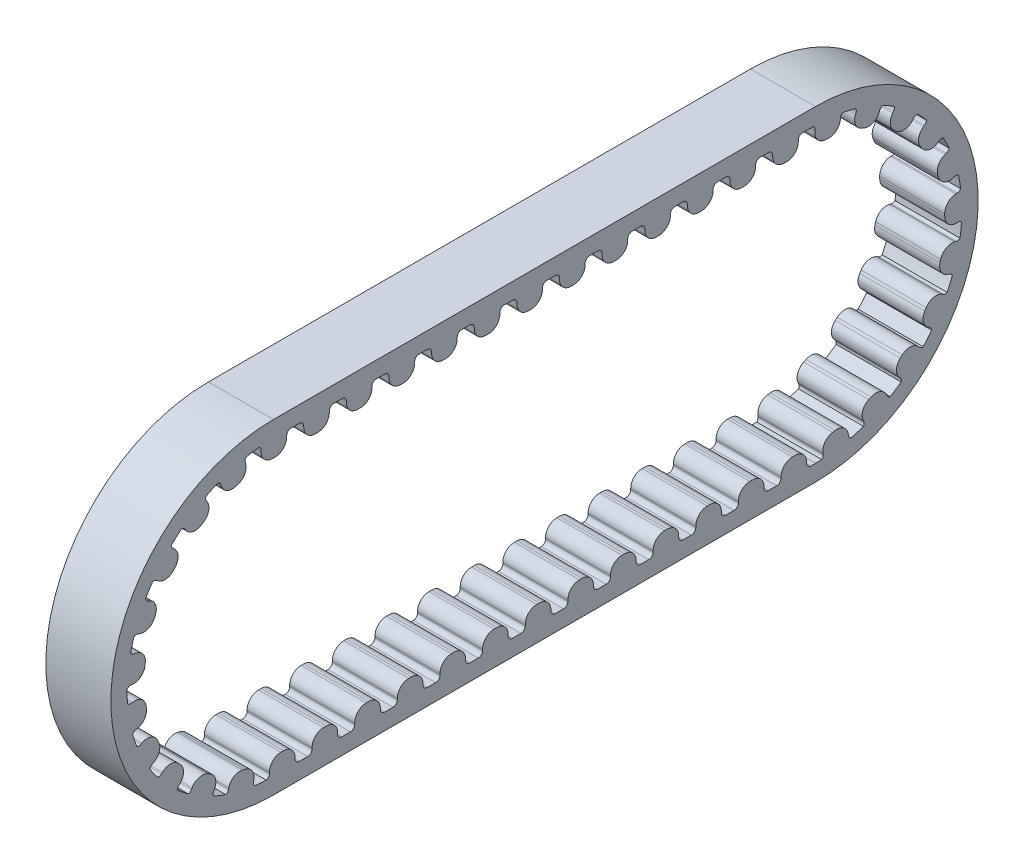
from build123d import *

# Parameters (mm, degrees)
BOSS_EXTRUDE1_DEPTH = 3
BOSS_EXTRUDE2_DEPTH = 3
CRVPATTERN1_DEPTH   = 3


# Read off the part's stored shape, not the designer's step: CrvPattern1
with BuildPart() as part:
    # Sketch1 → Boss-Extrude1 (new body)
    with BuildSketch(Plane(origin=(0, 0, 0), x_dir=(0, 0, -1), z_dir=(1, 0, 0))):
        with BuildLine():
            Line((0, 7.5), (25, 7.5))
            ThreePointArc((25, 7.5), (32.5, 0), (25, -7.5))
            Line((25, -7.5), (0, -7.5))
            ThreePointArc((0, -7.5), (-7.5, 0), (0, 7.5))
        make_face()
        with BuildLine():
            Line((0, 6.75), (25, 6.75))
            ThreePointArc((25, 6.75), (31.75, 0), (25, -6.75))
            Line((25, -6.75), (0, -6.75))
            ThreePointArc((0, -6.75), (-6.75, 0), (0, 6.75))
        make_face(mode=Mode.SUBTRACT)
    extrude(amount=BOSS_EXTRUDE1_DEPTH)

    # Sketch2 → Boss-Extrude2 (add)
    with BuildSketch(Plane(origin=(3, 0, 0), x_dir=(0, 0, -1), z_dir=(1, 0, 0))):
        with BuildLine():
            Line((1.39472131, 6.55), (1.39472131, 6.49))
            ThreePointArc((1.39472131, 6.49), (1.549954716, 6.115233406), (1.92472131, 5.96))
            Line((1.92472131, 5.96), (2.04472131, 5.96))
            ThreePointArc((2.04472131, 5.96), (2.419487904, 6.115233406), (2.57472131, 6.49))
            Line((2.57472131, 6.49), (2.57472131, 6.55))
            ThreePointArc((2.57472131, 6.55), (2.633299954, 6.691421356), (2.77472131, 6.75))
            ThreePointArc((2.77472131, 6.75), (1.98472131, 6.794721429), (1.19472131, 6.75))
            ThreePointArc((1.19472131, 6.75), (1.336142666, 6.691421356), (1.39472131, 6.55))
        make_face()
    extrude(amount=-BOSS_EXTRUDE2_DEPTH)

    # CrvPattern1 outline → CrvPattern1 (add)
    with BuildSketch(Plane.YZ):
        with BuildLine():
            ThreePointArc((6.49, 0.571480835), (6.115233406, 0.416247429), (5.96, 0.041480835))
            Line((5.96, 0.041480835), (5.96, -0.078519165))
            ThreePointArc((5.96, -0.078519165), (6.115233406, -0.453285759), (6.49, -0.608519165))
            Line((6.49, -0.608519165), (6.55, -0.608519165))
            ThreePointArc((6.55, -0.608519165), (6.691421356, -0.667097809), (6.75, -0.808519165))
            Line((6.75, -0.808519165), (6.75, 0))
            ThreePointArc((6.75, 0), (6.741857053, 0.331456604), (6.717447858, 0.662113495))
            ThreePointArc((6.717447858, 0.662113495), (6.645201187, 0.595592422), (6.55, 0.571480835))
            Line((6.55, 0.571480835), (6.49, 0.571480835))
        make_face()
        with BuildLine():
            ThreePointArc((6.55, -4.540923455), (6.691421356, -4.599502099), (6.75, -4.740923455))
            Line((6.75, -4.740923455), (6.75, -3.160923455))
            ThreePointArc((6.75, -3.160923455), (6.691421356, -3.302344811), (6.55, -3.360923455))
            Line((6.55, -3.360923455), (6.49, -3.360923455))
            ThreePointArc((6.49, -3.360923455), (6.115233406, -3.516156861), (5.96, -3.890923455))
            Line((5.96, -3.890923455), (5.96, -4.010923455))
            ThreePointArc((5.96, -4.010923455), (6.115233406, -4.385690049), (6.49, -4.540923455))
            Line((6.49, -4.540923455), (6.55, -4.540923455))
        make_face()
        with BuildLine():
            ThreePointArc((6.55, -6.5071256), (6.691421356, -6.565704244), (6.75, -6.7071256))
            Line((6.75, -6.7071256), (6.75, -5.1271256))
            ThreePointArc((6.75, -5.1271256), (6.691421357, -5.268546957), (6.55, -5.3271256))
            Line((6.55, -5.3271256), (6.49, -5.3271256))
            ThreePointArc((6.49, -5.3271256), (6.115233406, -5.482359006), (5.96, -5.8571256))
            Line((5.96, -5.8571256), (5.96, -5.9771256))
            ThreePointArc((5.96, -5.9771256), (6.115233406, -6.351892194), (6.49, -6.5071256))
            Line((6.49, -6.5071256), (6.55, -6.5071256))
        make_face()
        with BuildLine():
            ThreePointArc((6.55, -8.473327746), (6.691421357, -8.531906389), (6.75, -8.673327746))
            Line((6.75, -8.673327746), (6.75, -7.093327746))
            ThreePointArc((6.75, -7.093327746), (6.691421356, -7.234749102), (6.55, -7.293327746))
            Line((6.55, -7.293327746), (6.49, -7.293327746))
            ThreePointArc((6.49, -7.293327746), (6.115233406, -7.448561152), (5.96, -7.823327746))
            Line((5.96, -7.823327746), (5.96, -7.943327746))
            ThreePointArc((5.96, -7.943327746), (6.115233406, -8.31809434), (6.49, -8.473327746))
            Line((6.49, -8.473327746), (6.55, -8.473327746))
        make_face()
        with BuildLine():
            ThreePointArc((6.55, -10.439529891), (6.691421356, -10.498108535), (6.75, -10.639529891))
            Line((6.75, -10.639529891), (6.75, -9.059529891))
            ThreePointArc((6.75, -9.059529891), (6.691421356, -9.200951247), (6.55, -9.259529891))
            Line((6.55, -9.259529891), (6.49, -9.259529891))
            ThreePointArc((6.49, -9.259529891), (6.115233406, -9.414763297), (5.96, -9.789529891))
            Line((5.96, -9.789529891), (5.96, -9.909529891))
            ThreePointArc((5.96, -9.909529891), (6.115233406, -10.284296485), (6.49, -10.439529891))
            Line((6.49, -10.439529891), (6.55, -10.439529891))
        make_face()
        with BuildLine():
            ThreePointArc((6.55, -12.405732036), (6.691421356, -12.46431068), (6.75, -12.605732036))
            Line((6.75, -12.605732036), (6.75, -11.025732036))
            ThreePointArc((6.75, -11.025732036), (6.691421356, -11.167153392), (6.55, -11.225732036))
            Line((6.55, -11.225732036), (6.49, -11.225732036))
            ThreePointArc((6.49, -11.225732036), (6.115233406, -11.380965442), (5.96, -11.755732036))
            Line((5.96, -11.755732036), (5.96, -11.875732036))
            ThreePointArc((5.96, -11.875732036), (6.115233406, -12.25049863), (6.49, -12.405732036))
            Line((6.49, -12.405732036), (6.55, -12.405732036))
        make_face()
        with BuildLine():
            ThreePointArc((6.55, -14.371934181), (6.691421356, -14.430512825), (6.75, -14.571934181))
            Line((6.75, -14.571934181), (6.75, -12.991934181))
            ThreePointArc((6.75, -12.991934181), (6.691421356, -13.133355537), (6.55, -13.191934181))
            Line((6.55, -13.191934181), (6.49, -13.191934181))
            ThreePointArc((6.49, -13.191934181), (6.115233406, -13.347167587), (5.96, -13.721934181))
            Line((5.96, -13.721934181), (5.96, -13.841934181))
            ThreePointArc((5.96, -13.841934181), (6.115233406, -14.216700775), (6.49, -14.371934181))
            Line((6.49, -14.371934181), (6.55, -14.371934181))
        make_face()
        with BuildLine():
            ThreePointArc((6.55, -16.338136326), (6.691421356, -16.39671497), (6.75, -16.538136326))
            Line((6.75, -16.538136326), (6.75, -14.958136326))
            ThreePointArc((6.75, -14.958136326), (6.691421357, -15.099557683), (6.55, -15.158136326))
            Line((6.55, -15.158136326), (6.49, -15.158136326))
            ThreePointArc((6.49, -15.158136326), (6.115233406, -15.313369732), (5.96, -15.688136326))
            Line((5.96, -15.688136326), (5.96, -15.808136326))
            ThreePointArc((5.96, -15.808136326), (6.115233406, -16.18290292), (6.49, -16.338136326))
            Line((6.49, -16.338136326), (6.55, -16.338136326))
        make_face()
        with BuildLine():
            ThreePointArc((6.55, -18.304338471), (6.691421356, -18.362917115), (6.75, -18.504338471))
            Line((6.75, -18.504338471), (6.75, -16.924338471))
            ThreePointArc((6.75, -16.924338471), (6.691421357, -17.065759827), (6.55, -17.124338471))
            Line((6.55, -17.124338471), (6.49, -17.124338471))
            ThreePointArc((6.49, -17.124338471), (6.115233406, -17.279571877), (5.96, -17.654338471))
            Line((5.96, -17.654338471), (5.96, -17.774338471))
            ThreePointArc((5.96, -17.774338471), (6.115233405, -18.149105065), (6.49, -18.304338471))
            Line((6.49, -18.304338471), (6.55, -18.304338471))
        make_face()
        with BuildLine():
            ThreePointArc((6.55, -20.270540617), (6.691421357, -20.329119261), (6.75, -20.470540617))
            Line((6.75, -20.470540617), (6.75, -18.890540617))
            ThreePointArc((6.75, -18.890540617), (6.691421356, -19.031961973), (6.55, -19.090540617))
            Line((6.55, -19.090540617), (6.49, -19.090540617))
            ThreePointArc((6.49, -19.090540617), (6.115233406, -19.245774023), (5.96, -19.620540617))
            Line((5.96, -19.620540617), (5.96, -19.740540617))
            ThreePointArc((5.96, -19.740540617), (6.115233406, -20.115307211), (6.49, -20.270540617))
            Line((6.49, -20.270540617), (6.55, -20.270540617))
        make_face()
        with BuildLine():
            ThreePointArc((6.55, -22.236742762), (6.691421356, -22.295321406), (6.75, -22.436742762))
            Line((6.75, -22.436742762), (6.75, -20.856742762))
            ThreePointArc((6.75, -20.856742762), (6.691421356, -20.998164118), (6.55, -21.056742762))
            Line((6.55, -21.056742762), (6.49, -21.056742762))
            ThreePointArc((6.49, -21.056742762), (6.115233406, -21.211976168), (5.96, -21.586742762))
            Line((5.96, -21.586742762), (5.96, -21.706742762))
            ThreePointArc((5.96, -21.706742762), (6.115233406, -22.081509356), (6.49, -22.236742762))
            Line((6.49, -22.236742762), (6.55, -22.236742762))
        make_face()
        with BuildLine():
            ThreePointArc((6.55, -24.202944907), (6.691421356, -24.261523551), (6.75, -24.402944907))
            Line((6.75, -24.402944907), (6.75, -22.822944907))
            ThreePointArc((6.75, -22.822944907), (6.691421356, -22.964366263), (6.55, -23.022944907))
            Line((6.55, -23.022944907), (6.49, -23.022944907))
            ThreePointArc((6.49, -23.022944907), (6.115233406, -23.178178313), (5.96, -23.552944907))
            Line((5.96, -23.552944907), (5.96, -23.672944907))
            ThreePointArc((5.96, -23.672944907), (6.115233406, -24.047711501), (6.49, -24.202944907))
            Line((6.49, -24.202944907), (6.55, -24.202944907))
        make_face()
        with BuildLine():
            ThreePointArc((6.475346005, -26.149127546), (6.566914375, -26.180514693), (6.633018294, -26.251226724))
            ThreePointArc((6.633018294, -26.251226724), (6.720690942, -25.628341673), (6.75, -25))
            Line((6.75, -25), (6.75, -24.898864845))
            ThreePointArc((6.75, -24.898864845), (6.672594942, -24.957944108), (6.576465317, -24.973468206))
            Line((6.576465317, -24.973468206), (6.516686028, -24.968326546))
            ThreePointArc((6.516686028, -24.968326546), (6.1299954, -25.090873549), (5.943217651, -25.450958931))
            Line((5.943217651, -25.450958931), (5.932934331, -25.570517508))
            ThreePointArc((5.932934331, -25.570517508), (6.055481334, -25.957208137), (6.415566716, -26.143985886))
            Line((6.415566716, -26.143985886), (6.475346005, -26.149127546))
        make_face()
        with BuildLine():
            ThreePointArc((5.872553441, -27.960357425), (5.951250449, -28.016719649), (5.994262101, -28.103437105))
            ThreePointArc((5.994262101, -28.103437105), (6.275748601, -27.485453579), (6.493718219, -26.842314765))
            ThreePointArc((6.493718219, -26.842314765), (6.402995297, -26.87606785), (6.307047548, -26.863263595))
            Line((6.307047548, -26.863263595), (6.251263116, -26.841170675))
            ThreePointArc((6.251263116, -26.841170675), (5.845668101, -26.847502654), (5.5633465, -27.138779024))
            Line((5.5633465, -27.138779024), (5.519160659, -27.250347888))
            ThreePointArc((5.519160659, -27.250347888), (5.525492638, -27.655942903), (5.816769009, -27.938264504))
            Line((5.816769009, -27.938264504), (5.872553441, -27.960357425))
        make_face()
        with BuildLine():
            ThreePointArc((4.774991529, -29.522173803), (4.834186862, -29.598762522), (4.850482466, -29.694179358))
            ThreePointArc((4.850482466, -29.694179358), (5.297588245, -29.183068107), (5.691077106, -28.629620003))
            ThreePointArc((5.691077106, -28.629620003), (5.594482479, -28.635896744), (5.506253805, -28.596076895))
            Line((5.506253805, -28.596076895), (5.459164132, -28.558894067))
            ThreePointArc((5.459164132, -28.558894067), (5.068836575, -28.448477545), (4.714757041, -28.646404537))
            Line((4.714757041, -28.646404537), (4.640391385, -28.740583884))
            ThreePointArc((4.640391385, -28.740583884), (4.529974864, -29.130911441), (4.727901855, -29.484990975))
            Line((4.727901855, -29.484990975), (4.774991529, -29.522173803))
        make_face()
        with BuildLine():
            ThreePointArc((3.275131115, -30.702991862), (3.309837499, -30.793354389), (3.298044132, -30.889431628))
            ThreePointArc((3.298044132, -30.889431628), (3.873100016, -30.52825436), (4.408956235, -30.111125602))
            ThreePointArc((4.408956235, -30.111125602), (4.314628112, -30.089397175), (4.241551878, -30.0259166))
            Line((4.241551878, -30.0259166), (4.207124322, -29.976776561))
            ThreePointArc((4.207124322, -29.976776561), (3.864949766, -29.758914257), (3.468943904, -29.846816294))
            Line((3.468943904, -29.846816294), (3.370663827, -29.915671406))
            ThreePointArc((3.370663827, -29.915671406), (3.152801523, -30.257845962), (3.24070356, -30.653851823))
            Line((3.24070356, -30.653851823), (3.275131115, -30.702991862))
        make_face()
        with BuildLine():
            ThreePointArc((1.499337157, -31.40332633), (1.506630539, -31.499849519), (1.467741805, -31.588492543))
            ThreePointArc((1.467741805, -31.588492543), (2.122298677, -31.407678856), (2.755375754, -31.16201302))
            ThreePointArc((2.755375754, -31.16201302), (2.671261387, -31.114110071), (2.61949435, -31.03231708))
            Line((2.61949435, -31.03231708), (2.600629473, -30.975359934))
            ThreePointArc((2.600629473, -30.975359934), (2.335436516, -30.668406997), (1.930868274, -30.638878231))
            Line((1.930868274, -30.638878231), (1.816953983, -30.676607986))
            ThreePointArc((1.816953983, -30.676607986), (1.510001045, -30.941800943), (1.48047228, -31.346369185))
            Line((1.48047228, -31.346369185), (1.499337157, -31.40332633))
        make_face()
        with BuildLine():
            ThreePointArc((-0.402777672, -31.564173226), (-0.423511769, -31.658724887), (-0.486219448, -31.732465421))
            ThreePointArc((-0.486219448, -31.732465421), (0.192691247, -31.747249075), (0.869651713, -31.693743788))
            ThreePointArc((0.869651713, -31.693743788), (0.802837833, -31.623702195), (0.776741425, -31.530487942))
            Line((0.776741425, -31.530487942), (0.775028614, -31.470512394))
            ThreePointArc((0.775028614, -31.470512394), (0.609160066, -31.100329959), (0.230114781, -30.955858224))
            Line((0.230114781, -30.955858224), (0.110163687, -30.959283846))
            ThreePointArc((0.110163687, -30.959283846), (-0.260018748, -31.125152394), (-0.404490483, -31.504197679))
            Line((-0.404490483, -31.504197679), (-0.402777672, -31.564173226))
        make_face()
        with BuildLine():
            ThreePointArc((-2.270958022, -31.171981016), (-2.317972725, -31.256595064), (-2.399216157, -31.309220382))
            ThreePointArc((-2.399216157, -31.309220382), (-1.753150642, -31.518355838), (-1.089341481, -31.661518981))
            ThreePointArc((-1.089341481, -31.661518981), (-1.133225727, -31.575239828), (-1.131452853, -31.478457721))
            Line((-1.131452853, -31.478457721), (-1.115869292, -31.42051678))
            ThreePointArc((-1.115869292, -31.42051678), (-1.168438816, -31.018293141), (-1.490026145, -30.771050345))
            Line((-1.490026145, -30.771050345), (-1.605908026, -30.739883223))
            ThreePointArc((-1.605908026, -30.739883223), (-2.008131665, -30.792452746), (-2.255374461, -31.114040075))
            Line((-2.255374461, -31.114040075), (-2.270958022, -31.171981016))
        make_face()
        with BuildLine():
            ThreePointArc((-3.947807559, -30.259792341), (-4.017141826, -30.327339946), (-4.110076158, -30.354416306))
            ThreePointArc((-4.110076158, -30.354416306), (-3.551287582, -30.740283661), (-2.956556408, -31.068053577))
            ThreePointArc((-2.956556408, -31.068053577), (-2.973813723, -30.972805981), (-2.944320934, -30.880610022))
            Line((-2.944320934, -30.880610022), (-2.912753933, -30.829585279))
            ThreePointArc((-2.912753933, -30.829585279), (-2.84759539, -30.429208238), (-3.084630663, -30.10002487))
            Line((-3.084630663, -30.10002487), (-3.18668015, -30.036890869))
            ThreePointArc((-3.18668015, -30.036890869), (-3.587057191, -29.971732325), (-3.916240559, -30.208767598))
            Line((-3.916240559, -30.208767598), (-3.947807559, -30.259792341))
        make_face()
        with BuildLine():
            ThreePointArc((-5.292049792, -28.904460142), (-5.377862131, -28.94925034), (-5.47465754, -28.948496527))
            ThreePointArc((-5.47465754, -28.948496527), (-5.05022448, -29.478586016), (-4.574678073, -29.963347713))
            ThreePointArc((-4.574678073, -29.963347713), (-4.563854509, -29.867156395), (-4.509126607, -29.7873142))
            Line((-4.509126607, -29.7873142), (-4.464235722, -29.747504546))
            ThreePointArc((-4.464235722, -29.747504546), (-4.286838794, -29.382706328), (-4.419351517, -28.999316463))
            Line((-4.419351517, -28.999316463), (-4.498970824, -28.909534694))
            ThreePointArc((-4.498970824, -28.909534694), (-4.863769042, -28.732137766), (-5.247158907, -28.864650489))
            Line((-5.247158907, -28.864650489), (-5.292049792, -28.904460142))
        make_face()
        with BuildLine():
            ThreePointArc((-6.190430772, -27.220172708), (-6.285491396, -27.238431873), (-6.377992758, -27.209911397))
            ThreePointArc((-6.377992758, -27.209911397), (-6.123674185, -27.839562373), (-5.807377876, -28.440474125))
            ThreePointArc((-5.807377876, -28.440474125), (-5.769385329, -28.351443311), (-5.694033202, -28.290681676))
            Line((-5.694033202, -28.290681676), (-5.639600543, -28.265441122))
            ThreePointArc((-5.639600543, -28.265441122), (-5.364911123, -27.966956393), (-5.381736948, -27.561661066))
            Line((-5.381736948, -27.561661066), (-5.432218057, -27.452795747))
            ThreePointArc((-5.432218057, -27.452795747), (-5.730702786, -27.178106328), (-6.135998113, -27.194932153))
            Line((-6.135998113, -27.194932153), (-6.190430772, -27.220172708))
        make_face()
        with BuildLine():
            ThreePointArc((-6.567260876, -25.348833182), (-6.663560818, -25.33902296), (-6.743974786, -25.285138703))
            ThreePointArc((-6.743974786, -25.285138703), (-6.681197332, -25.961302351), (-6.550799446, -26.627736654))
            ThreePointArc((-6.550799446, -26.627736654), (-6.488838833, -26.553367294), (-6.399210983, -26.516805456))
            Line((-6.399210983, -26.516805456), (-6.339822563, -26.508260546))
            ThreePointArc((-6.339822563, -26.508260546), (-5.990983551, -26.301236987), (-5.890704883, -25.908182793))
            Line((-5.890704883, -25.908182793), (-5.907794702, -25.789405952))
            ThreePointArc((-5.907794702, -25.789405952), (-6.114818262, -25.44056694), (-6.507872455, -25.340288272))
            Line((-6.507872455, -25.340288272), (-6.567260876, -25.348833182))
        make_face()
        with BuildLine():
            ThreePointArc((-6.55, -23.408379763), (-6.691421356, -23.349801119), (-6.75, -23.208379763))
            Line((-6.75, -23.208379763), (-6.75, -24.788379763))
            ThreePointArc((-6.75, -24.788379763), (-6.691421356, -24.646958406), (-6.55, -24.588379763))
            Line((-6.55, -24.588379763), (-6.49, -24.588379763))
            ThreePointArc((-6.49, -24.588379763), (-6.115233406, -24.433146357), (-5.96, -24.058379763))
            Line((-5.96, -24.058379763), (-5.96, -23.938379763))
            ThreePointArc((-5.96, -23.938379763), (-6.115233406, -23.563613169), (-6.49, -23.408379763))
            Line((-6.49, -23.408379763), (-6.55, -23.408379763))
        make_face()
        with BuildLine():
            ThreePointArc((-6.55, -21.442177617), (-6.691421357, -21.383598973), (-6.75, -21.242177617))
            Line((-6.75, -21.242177617), (-6.75, -22.822177617))
            ThreePointArc((-6.75, -22.822177617), (-6.691421356, -22.680756261), (-6.55, -22.622177617))
            Line((-6.55, -22.622177617), (-6.49, -22.622177617))
            ThreePointArc((-6.49, -22.622177617), (-6.115233406, -22.466944211), (-5.96, -22.092177617))
            Line((-5.96, -22.092177617), (-5.96, -21.972177617))
            ThreePointArc((-5.96, -21.972177617), (-6.115233406, -21.597411023), (-6.49, -21.442177617))
            Line((-6.49, -21.442177617), (-6.55, -21.442177617))
        make_face()
        with BuildLine():
            ThreePointArc((-6.55, -19.475975472), (-6.691421356, -19.417396828), (-6.75, -19.275975472))
            Line((-6.75, -19.275975472), (-6.75, -20.855975472))
            ThreePointArc((-6.75, -20.855975472), (-6.691421356, -20.714554116), (-6.55, -20.655975472))
            Line((-6.55, -20.655975472), (-6.49, -20.655975472))
            ThreePointArc((-6.49, -20.655975472), (-6.115233406, -20.500742066), (-5.96, -20.125975472))
            Line((-5.96, -20.125975472), (-5.96, -20.005975472))
            ThreePointArc((-5.96, -20.005975472), (-6.115233406, -19.631208878), (-6.49, -19.475975472))
            Line((-6.49, -19.475975472), (-6.55, -19.475975472))
        make_face()
        with BuildLine():
            ThreePointArc((-6.55, -17.509773327), (-6.691421356, -17.451194683), (-6.75, -17.309773327))
            Line((-6.75, -17.309773327), (-6.75, -18.889773327))
            ThreePointArc((-6.75, -18.889773327), (-6.691421356, -18.748351971), (-6.55, -18.689773327))
            Line((-6.55, -18.689773327), (-6.49, -18.689773327))
            ThreePointArc((-6.49, -18.689773327), (-6.115233406, -18.534539921), (-5.96, -18.159773327))
            Line((-5.96, -18.159773327), (-5.96, -18.039773327))
            ThreePointArc((-5.96, -18.039773327), (-6.115233406, -17.665006733), (-6.49, -17.509773327))
            Line((-6.49, -17.509773327), (-6.55, -17.509773327))
        make_face()
        with BuildLine():
            ThreePointArc((-6.55, -15.543571182), (-6.691421356, -15.484992538), (-6.75, -15.343571182))
            Line((-6.75, -15.343571182), (-6.75, -16.923571182))
            ThreePointArc((-6.75, -16.923571182), (-6.691421356, -16.782149826), (-6.55, -16.723571182))
            Line((-6.55, -16.723571182), (-6.49, -16.723571182))
            ThreePointArc((-6.49, -16.723571182), (-6.115233406, -16.568337776), (-5.96, -16.193571182))
            Line((-5.96, -16.193571182), (-5.96, -16.073571182))
            ThreePointArc((-5.96, -16.073571182), (-6.115233406, -15.698804588), (-6.49, -15.543571182))
            Line((-6.49, -15.543571182), (-6.55, -15.543571182))
        make_face()
        with BuildLine():
            ThreePointArc((-6.55, -13.577369037), (-6.691421356, -13.518790393), (-6.75, -13.377369037))
            Line((-6.75, -13.377369037), (-6.75, -14.957369037))
            ThreePointArc((-6.75, -14.957369037), (-6.691421356, -14.81594768), (-6.55, -14.757369037))
            Line((-6.55, -14.757369037), (-6.49, -14.757369037))
            ThreePointArc((-6.49, -14.757369037), (-6.115233406, -14.602135631), (-5.96, -14.227369037))
            Line((-5.96, -14.227369037), (-5.96, -14.107369037))
            ThreePointArc((-5.96, -14.107369037), (-6.115233406, -13.732602443), (-6.49, -13.577369037))
            Line((-6.49, -13.577369037), (-6.55, -13.577369037))
        make_face()
        with BuildLine():
            ThreePointArc((-6.55, -11.611166891), (-6.691421356, -11.552588248), (-6.75, -11.411166891))
            Line((-6.75, -11.411166891), (-6.75, -12.991166891))
            ThreePointArc((-6.75, -12.991166891), (-6.691421356, -12.849745535), (-6.55, -12.791166891))
            Line((-6.55, -12.791166891), (-6.49, -12.791166891))
            ThreePointArc((-6.49, -12.791166891), (-6.115233406, -12.635933485), (-5.96, -12.261166891))
            Line((-5.96, -12.261166891), (-5.96, -12.141166891))
            ThreePointArc((-5.96, -12.141166891), (-6.115233406, -11.766400297), (-6.49, -11.611166891))
            Line((-6.49, -11.611166891), (-6.55, -11.611166891))
        make_face()
        with BuildLine():
            ThreePointArc((-6.55, -9.644964746), (-6.691421357, -9.586386103), (-6.75, -9.444964746))
            Line((-6.75, -9.444964746), (-6.75, -11.024964746))
            ThreePointArc((-6.75, -11.024964746), (-6.691421356, -10.88354339), (-6.55, -10.824964746))
            Line((-6.55, -10.824964746), (-6.49, -10.824964746))
            ThreePointArc((-6.49, -10.824964746), (-6.115233406, -10.66973134), (-5.96, -10.294964746))
            Line((-5.96, -10.294964746), (-5.96, -10.174964746))
            ThreePointArc((-5.96, -10.174964746), (-6.115233406, -9.800198152), (-6.49, -9.644964746))
            Line((-6.49, -9.644964746), (-6.55, -9.644964746))
        make_face()
        with BuildLine():
            ThreePointArc((-6.55, -7.678762601), (-6.691421356, -7.620183957), (-6.75, -7.478762601))
            Line((-6.75, -7.478762601), (-6.75, -9.058762601))
            ThreePointArc((-6.75, -9.058762601), (-6.691421356, -8.917341245), (-6.55, -8.858762601))
            Line((-6.55, -8.858762601), (-6.49, -8.858762601))
            ThreePointArc((-6.49, -8.858762601), (-6.115233406, -8.703529195), (-5.96, -8.328762601))
            Line((-5.96, -8.328762601), (-5.96, -8.208762601))
            ThreePointArc((-5.96, -8.208762601), (-6.115233406, -7.833996007), (-6.49, -7.678762601))
            Line((-6.49, -7.678762601), (-6.55, -7.678762601))
        make_face()
        with BuildLine():
            ThreePointArc((-6.55, -5.712560456), (-6.691421356, -5.653981812), (-6.75, -5.512560456))
            Line((-6.75, -5.512560456), (-6.75, -7.092560456))
            ThreePointArc((-6.75, -7.092560456), (-6.691421356, -6.9511391), (-6.55, -6.892560456))
            Line((-6.55, -6.892560456), (-6.49, -6.892560456))
            ThreePointArc((-6.49, -6.892560456), (-6.115233406, -6.73732705), (-5.96, -6.362560456))
            Line((-5.96, -6.362560456), (-5.96, -6.242560456))
            ThreePointArc((-5.96, -6.242560456), (-6.115233406, -5.867793862), (-6.49, -5.712560456))
            Line((-6.49, -5.712560456), (-6.55, -5.712560456))
        make_face()
        with BuildLine():
            ThreePointArc((-6.55, -3.746358311), (-6.691421356, -3.687779667), (-6.75, -3.546358311))
            Line((-6.75, -3.546358311), (-6.75, -5.126358311))
            ThreePointArc((-6.75, -5.126358311), (-6.691421356, -4.984936955), (-6.55, -4.926358311))
            Line((-6.55, -4.926358311), (-6.49, -4.926358311))
            ThreePointArc((-6.49, -4.926358311), (-6.115233406, -4.771124905), (-5.96, -4.396358311))
            Line((-5.96, -4.396358311), (-5.96, -4.276358311))
            ThreePointArc((-5.96, -4.276358311), (-6.115233406, -3.901591717), (-6.49, -3.746358311))
            Line((-6.49, -3.746358311), (-6.55, -3.746358311))
        make_face()
        with BuildLine():
            ThreePointArc((-6.55, -1.780156166), (-6.691421356, -1.721577522), (-6.75, -1.580156166))
            Line((-6.75, -1.580156166), (-6.75, -3.160156166))
            ThreePointArc((-6.75, -3.160156166), (-6.691421357, -3.018734809), (-6.55, -2.960156166))
            Line((-6.55, -2.960156166), (-6.49, -2.960156166))
            ThreePointArc((-6.49, -2.960156166), (-6.115233406, -2.80492276), (-5.96, -2.430156166))
            Line((-5.96, -2.430156166), (-5.96, -2.310156166))
            ThreePointArc((-5.96, -2.310156166), (-6.115233406, -1.935389572), (-6.49, -1.780156166))
            Line((-6.49, -1.780156166), (-6.55, -1.780156166))
        make_face()
        with BuildLine():
            ThreePointArc((-6.55, 0.18604598), (-6.669909916, 0.225978457), (-6.741936833, 0.32982986))
            ThreePointArc((-6.741936833, 0.32982986), (-6.747983907, 0.164964202), (-6.75, 0))
            Line((-6.75, 0), (-6.75, -1.19395402))
            ThreePointArc((-6.75, -1.19395402), (-6.691421356, -1.052532664), (-6.55, -0.99395402))
            Line((-6.55, -0.99395402), (-6.49, -0.99395402))
            ThreePointArc((-6.49, -0.99395402), (-6.115233406, -0.838720614), (-5.96, -0.46395402))
            Line((-5.96, -0.46395402), (-5.96, -0.34395402))
            ThreePointArc((-5.96, -0.34395402), (-6.115233406, 0.030812574), (-6.49, 0.18604598))
            Line((-6.49, 0.18604598), (-6.55, 0.18604598))
        make_face()
        with BuildLine():
            ThreePointArc((-6.240015513, 2.076729737), (-6.326059184, 2.121073914), (-6.381200778, 2.200630963))
            ThreePointArc((-6.381200778, 2.200630963), (-6.57001896, 1.548338097), (-6.692341948, 0.880374494))
            ThreePointArc((-6.692341948, 0.880374494), (-6.607478143, 0.92693686), (-6.510687951, 0.928193089))
            Line((-6.510687951, 0.928193089), (-6.452287782, 0.914430084))
            ThreePointArc((-6.452287782, 0.914430084), (-6.051905941, 0.979559125), (-5.814846413, 1.308725026))
            Line((-5.814846413, 1.308725026), (-5.787320402, 1.425525363))
            ThreePointArc((-5.787320402, 1.425525363), (-5.852449443, 1.825907204), (-6.181615344, 2.062966732))
            Line((-6.181615344, 2.062966732), (-6.240015513, 2.076729737))
        make_face()
        with BuildLine():
            ThreePointArc((-5.380740755, 3.7812999), (-5.4504247, 3.848486708), (-5.480395643, 3.940528339))
            ThreePointArc((-5.480395643, 3.940528339), (-5.848590019, 3.36993988), (-6.157590786, 2.765244242))
            ThreePointArc((-6.157590786, 2.765244242), (-6.062929794, 2.785473329), (-5.969856171, 2.758879718))
            Line((-5.969856171, 2.758879718), (-5.917868704, 2.728924697))
            ThreePointArc((-5.917868704, 2.728924697), (-5.51564894, 2.676325536), (-5.194043393, 2.923544634))
            Line((-5.194043393, 2.923544634), (-5.134133351, 3.027519568))
            ThreePointArc((-5.134133351, 3.027519568), (-5.081534189, 3.429739332), (-5.328753288, 3.751344878))
            Line((-5.328753288, 3.751344878), (-5.380740755, 3.7812999))
        make_face()
        with BuildLine():
            ThreePointArc((-4.06813243, 5.167291218), (-4.115585697, 5.251660092), (-4.117860904, 5.348431693))
            ThreePointArc((-4.117860904, 5.348431693), (-4.634410675, 4.90762037), (-5.104055552, 4.417138997))
            ThreePointArc((-5.104055552, 4.417138997), (-5.007572671, 4.409330481), (-4.926057176, 4.357127574))
            Line((-4.926057176, 4.357127574), (-4.884862415, 4.313504282))
            ThreePointArc((-4.884862415, 4.313504282), (-4.514692203, 4.147608457), (-4.135636273, 4.292052261))
            Line((-4.135636273, 4.292052261), (-4.048389689, 4.374441784))
            ThreePointArc((-4.048389689, 4.374441784), (-3.882493864, 4.744611996), (-4.026937669, 5.123667926))
            Line((-4.026937669, 5.123667926), (-4.06813243, 5.167291218))
        make_face()
        with BuildLine():
            ThreePointArc((-2.412779292, 6.117932338), (-2.434003889, 6.212375103), (-2.408391671, 6.305723556))
            ThreePointArc((-2.408391671, 6.305723556), (-3.029776928, 6.031828228), (-3.620497798, 5.696884736))
            ThreePointArc((-3.620497798, 5.696884736), (-3.530321819, 5.661696495), (-3.467232227, 5.588282445))
            Line((-3.467232227, 5.588282445), (-3.440300876, 5.534666194))
            ThreePointArc((-3.440300876, 5.534666194), (-3.133367481, 5.269450619), (-2.728797064, 5.298949573))
            Line((-2.728797064, 5.298949573), (-2.621564562, 5.352812274))
            ThreePointArc((-2.621564562, 5.352812274), (-2.356348988, 5.65974567), (-2.385847942, 6.064316087))
            Line((-2.385847942, 6.064316087), (-2.412779292, 6.117932338))
        make_face()
        with BuildLine():
            ThreePointArc((-0.554146738, 6.553130656), (-0.547354468, 6.649690401), (-0.496012683, 6.731750992))
            ThreePointArc((-0.496012683, 6.731750992), (-1.169881007, 6.647847654), (-1.83190896, 6.496661417))
            ThreePointArc((-1.83190896, 6.496661417), (-1.755637314, 6.437058099), (-1.716288994, 6.348618124))
            Line((-1.716288994, 6.348618124), (-1.705890052, 6.289526145))
            ThreePointArc((-1.705890052, 6.289526145), (-1.488052963, 5.947335536), (-1.092053579, 5.85940432))
            Line((-1.092053579, 5.85940432), (-0.973869621, 5.880202204))
            ThreePointArc((-0.973869621, 5.880202204), (-0.631679012, 6.098039294), (-0.543747796, 6.494038677))
            Line((-0.543747796, 6.494038677), (-0.554146738, 6.553130656))
        make_face()
        with BuildLine():
            ThreePointArc((1.351173314, 6.436220217), (1.385410194, 6.526761673), (1.458155941, 6.590620703))
            ThreePointArc((1.458155941, 6.590620703), (0.788578728, 6.703778307), (0.111020305, 6.749086938))
            ThreePointArc((0.111020305, 6.749086938), (0.166961644, 6.670090191), (0.17925355, 6.574075461))
            Line((0.17925355, 6.574075461), (0.172243962, 6.51448632))
            ThreePointArc((0.172243962, 6.51448632), (0.282631721, 6.124150628), (0.636696669, 5.926197546))
            Line((0.636696669, 5.926197546), (0.75587495, 5.912178368))
            ThreePointArc((0.75587495, 5.912178368), (1.146210643, 6.022566128), (1.344163725, 6.376631076))
            Line((1.344163725, 6.376631076), (1.351173314, 6.436220217))
        make_face()
        with BuildLine():
            ThreePointArc((3.142655467, 5.777050858), (3.201452461, 5.853945805), (3.289473258, 5.894223077))
            ThreePointArc((3.289473258, 5.894223077), (2.680599802, 6.194907966), (2.044595981, 6.43289416))
            ThreePointArc((2.044595981, 6.43289416), (2.075493892, 6.341159551), (2.059693778, 6.245659416))
            Line((2.059693778, 6.245659416), (2.035866224, 6.190593567))
            ThreePointArc((2.035866224, 6.190593567), (2.029504358, 5.784999019), (2.311804495, 5.493701846))
            Line((2.311804495, 5.493701846), (2.421936192, 5.446046739))
            ThreePointArc((2.421936192, 5.446046739), (2.827530739, 5.439684873), (3.118827913, 5.721985009))
            Line((3.118827913, 5.721985009), (3.142655467, 5.777050858))
        make_face()
        with BuildLine():
            ThreePointArc((4.6693653, 4.631158353), (4.747768695, 4.687928302), (4.843648689, 4.701230411))
            ThreePointArc((4.843648689, 4.701230411), (4.346777275, 5.164109538), (3.805912107, 5.574722687))
            ThreePointArc((3.805912107, 5.574722687), (3.809163405, 5.477978961), (3.766602448, 5.391039417))
            Line((3.766602448, 5.391039417), (3.727964428, 5.345136221))
            ThreePointArc((3.727964428, 5.345136221), (3.605388931, 4.958454624), (3.792140146, 4.598355479))
            Line((3.792140146, 4.598355479), (3.883946538, 4.521079439))
            ThreePointArc((3.883946538, 4.521079439), (4.270628135, 4.398503942), (4.63072728, 4.585255157))
            Line((4.63072728, 4.585255157), (4.6693653, 4.631158353))
        make_face()
        with BuildLine():
            ThreePointArc((5.802675764, 3.095085457), (5.894079982, 3.126947476), (5.989741174, 3.112153703))
            ThreePointArc((5.989741174, 3.112153703), (5.646733788, 3.698228972), (5.246575781, 4.246874448))
            ThreePointArc((5.246575781, 4.246874448), (5.221906541, 4.153272375), (5.156170551, 4.082218178))
            Line((5.156170551, 4.082218178), (5.105977361, 4.049345032))
            ThreePointArc((5.105977361, 4.049345032), (4.87751536, 3.714154751), (4.95298365, 3.3155924))
            Line((4.95298365, 3.3155924), (5.018729943, 3.215206022))
            ThreePointArc((5.018729943, 3.215206022), (5.353920223, 2.98674402), (5.752482574, 3.06221231))
            Line((5.752482574, 3.06221231), (5.802675764, 3.095085457))
        make_face()
        with BuildLine():
            ThreePointArc((6.447104153, 1.298248068), (6.543808285, 1.302517745), (6.63119111, 1.260874483))
            ThreePointArc((6.63119111, 1.260874483), (6.470946517, 1.920768383), (6.245209441, 2.561222176))
            ThreePointArc((6.245209441, 2.561222176), (6.194698075, 2.478647838), (6.111325383, 2.429465385))
            Line((6.111325383, 2.429465385), (6.053805859, 2.412391888))
            ThreePointArc((6.053805859, 2.412391888), (5.738705538, 2.15693309), (5.696532613, 1.753486867))
            Line((5.696532613, 1.753486867), (5.730679606, 1.638447818))
            ThreePointArc((5.730679606, 1.638447818), (5.986138405, 1.323347496), (6.389584628, 1.281174571))
            Line((6.389584628, 1.281174571), (6.447104153, 1.298248068))
        make_face()
    extrude(amount=CRVPATTERN1_DEPTH)


solid = part.part
